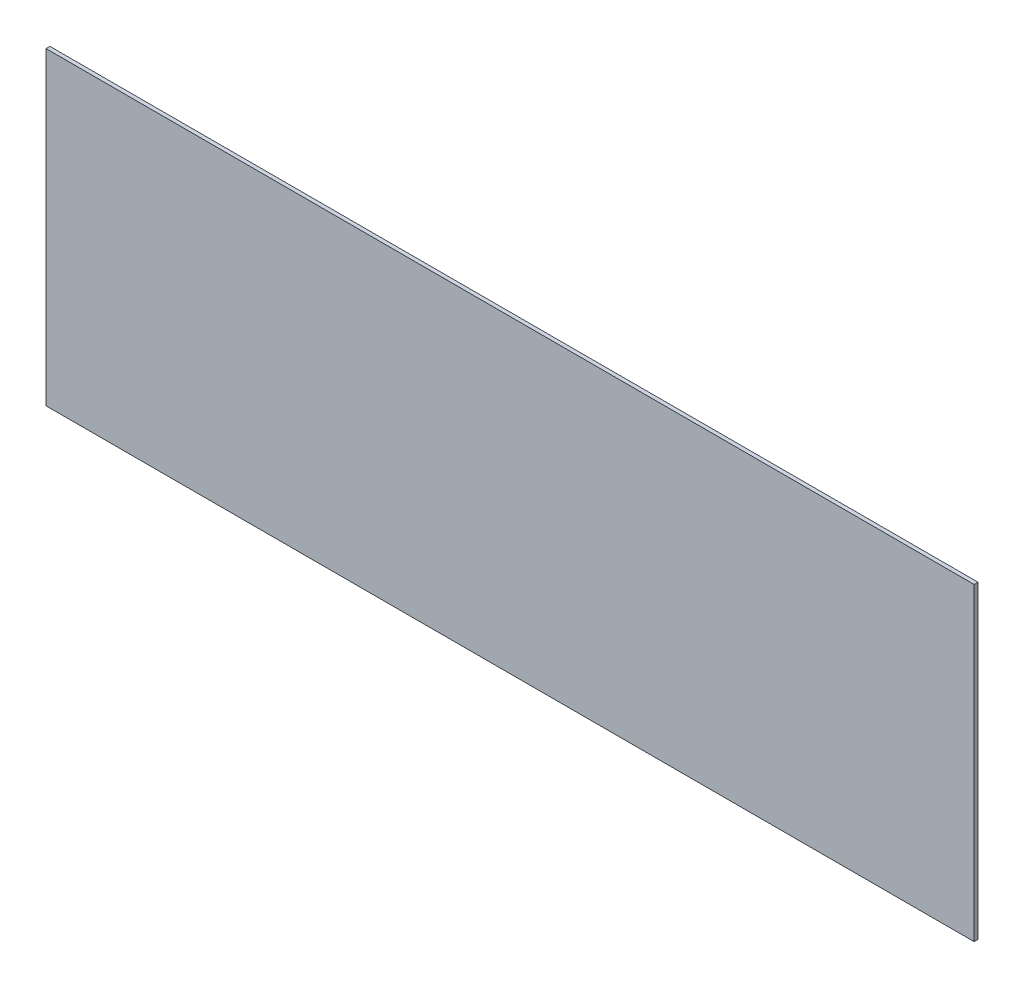
from build123d import *

# Parameters (mm, degrees)
SKETCH1_W           = 609.6
SKETCH1_H           = 203.2
BOSS_EXTRUDE1_DEPTH = 2.54


with BuildPart() as part:
    # Sketch1 → Boss-Extrude1 (new body)
    with BuildSketch(Plane.XY):
        with Locations((304.8, 101.6)):
            Rectangle(SKETCH1_W, SKETCH1_H)
    extrude(amount=BOSS_EXTRUDE1_DEPTH)


solid = part.part
